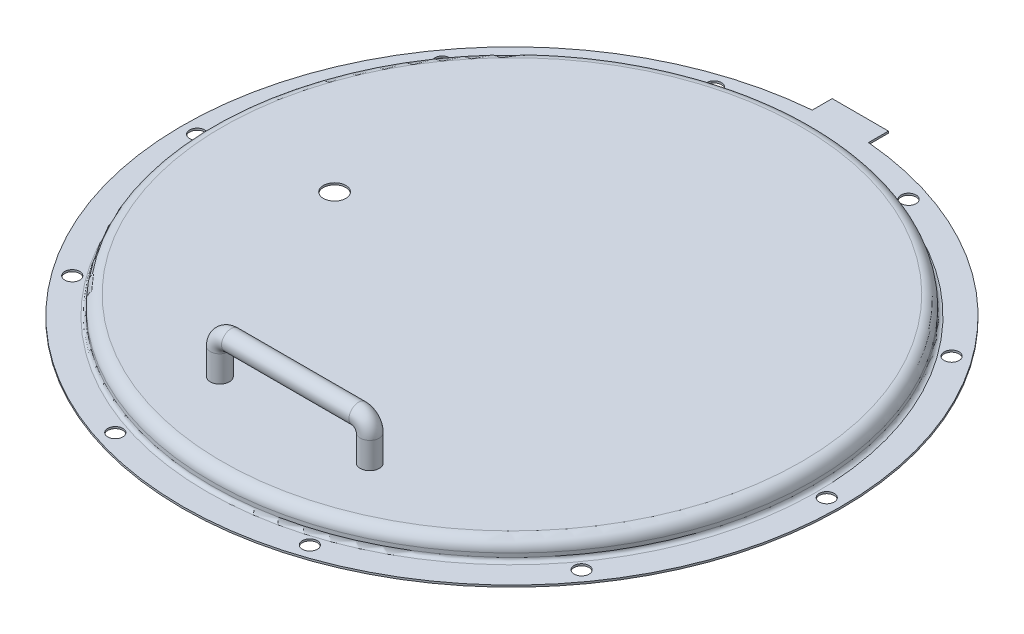
from build123d import *

# Parameters (mm, degrees)
BOSS_EXTRUDE1_OUTLINE_R   = 20
BOSS_EXTRUDE1_OUTLINE_R_2 = 800
BOSS_EXTRUDE1_DEPTH       = 5
FILLET1_R                 = 10
SKETCH3_R                 = 25.4
SKETCH7_R                 = 30
CUT_EXTRUDE1_DEPTH        = 50


# Read off the part's stored shape, not the designer's step: Boss-Extrude1
with BuildPart() as part:
    # Boss-Extrude1 outline → Boss-Extrude1 (new body)
    with BuildSketch(Plane(origin=(0, 0, 0), x_dir=(1, 0, 0), z_dir=(0, 1, 0))):
        with BuildLine():
            Line((75, 875.995228298), (75, 929.2))
            Line((75, 929.2), (-75, 929.2))
            Line((-75, 929.2), (-75, 875.995228298))
            ThreePointArc((-75, 875.995228298), (0, -879.2), (75, 875.995228298))
        make_face()
        with Locations((-679.250668477, -493.504497825)):
            Circle(BOSS_EXTRUDE1_OUTLINE_R, mode=Mode.SUBTRACT)
        with Locations((-259.450668477, -798.507051081)):
            Circle(BOSS_EXTRUDE1_OUTLINE_R, mode=Mode.SUBTRACT)
        with Locations((-839.6, 0)):
            Circle(BOSS_EXTRUDE1_OUTLINE_R, mode=Mode.SUBTRACT)
        with Locations((259.450668477, -798.507051081)):
            Circle(BOSS_EXTRUDE1_OUTLINE_R, mode=Mode.SUBTRACT)
        with Locations((679.250668477, -493.504497825)):
            Circle(BOSS_EXTRUDE1_OUTLINE_R, mode=Mode.SUBTRACT)
        Circle(BOSS_EXTRUDE1_OUTLINE_R_2, mode=Mode.SUBTRACT)
        with Locations((839.6, 0)):
            Circle(BOSS_EXTRUDE1_OUTLINE_R, mode=Mode.SUBTRACT)
        with Locations((-679.250668477, 493.504497825)):
            Circle(BOSS_EXTRUDE1_OUTLINE_R, mode=Mode.SUBTRACT)
        with Locations((-259.450668477, 798.507051081)):
            Circle(BOSS_EXTRUDE1_OUTLINE_R, mode=Mode.SUBTRACT)
        with Locations((259.450668477, 798.507051081)):
            Circle(BOSS_EXTRUDE1_OUTLINE_R, mode=Mode.SUBTRACT)
        with Locations((679.250668477, 493.504497825)):
            Circle(BOSS_EXTRUDE1_OUTLINE_R, mode=Mode.SUBTRACT)
    extrude(amount=BOSS_EXTRUDE1_DEPTH)

    # Sketch2 → Revolve1 (revolve)
    with BuildSketch(Plane.XY):
        with BuildLine():
            Line((803, 5), (803, 25))
            ThreePointArc((803, 25), (794.213203436, 46.213203436), (773, 55))
            Line((773, 55), (0, 55))
            Line((0, 55), (0, 50))
            Line((0, 50), (768, 50))
            ThreePointArc((768, 50), (789.213203436, 41.213203436), (798, 20))
            Line((798, 20), (798, 5))
            Line((798, 5), (803, 5))
        make_face()
    revolve(axis=Axis((0, 0, 0), (0, 1, 0)))

    # Fillet1
    fillet1_edges = [part.edges().sort_by_distance(p)[0] for p in [
        (-803, 5, 0),
    ]]
    fillet(fillet1_edges, radius=FILLET1_R)

    # Sketch7 → Cut-Extrude1 (cut)
    with BuildSketch(Plane(origin=(0, 55, 0), x_dir=(1, 0, 0), z_dir=(0, 1, 0))):
        with Locations(Location((-473, 0, 0), (0, 0, 180))):
            Circle(SKETCH7_R)
    extrude(amount=-CUT_EXTRUDE1_DEPTH, mode=Mode.SUBTRACT)


with BuildPart() as body_2:
    # Sweep1: sweep along a path in Sketch4
    with BuildLine(Plane.XY) as sweep1_path:
        Line((200, 55), (200, 125))
        ThreePointArc((200, 125), (191.213203436, 146.213203436), (170, 155))
        Line((170, 155), (-170, 155))
        ThreePointArc((-170, 155), (-191.213203436, 146.213203436), (-200, 125))
        Line((-200, 125), (-200, 55))
    # Sketch3 → Sweep1 (sweep)
    with BuildSketch(Plane(origin=(0, 55, 0), x_dir=(1, 0, 0), z_dir=(0, 1, 0))):
        with Locations((200, -579.2)):
            Circle(SKETCH3_R)
    sweep(path=sweep1_path.line)


solid = Compound([part.part, body_2.part])
